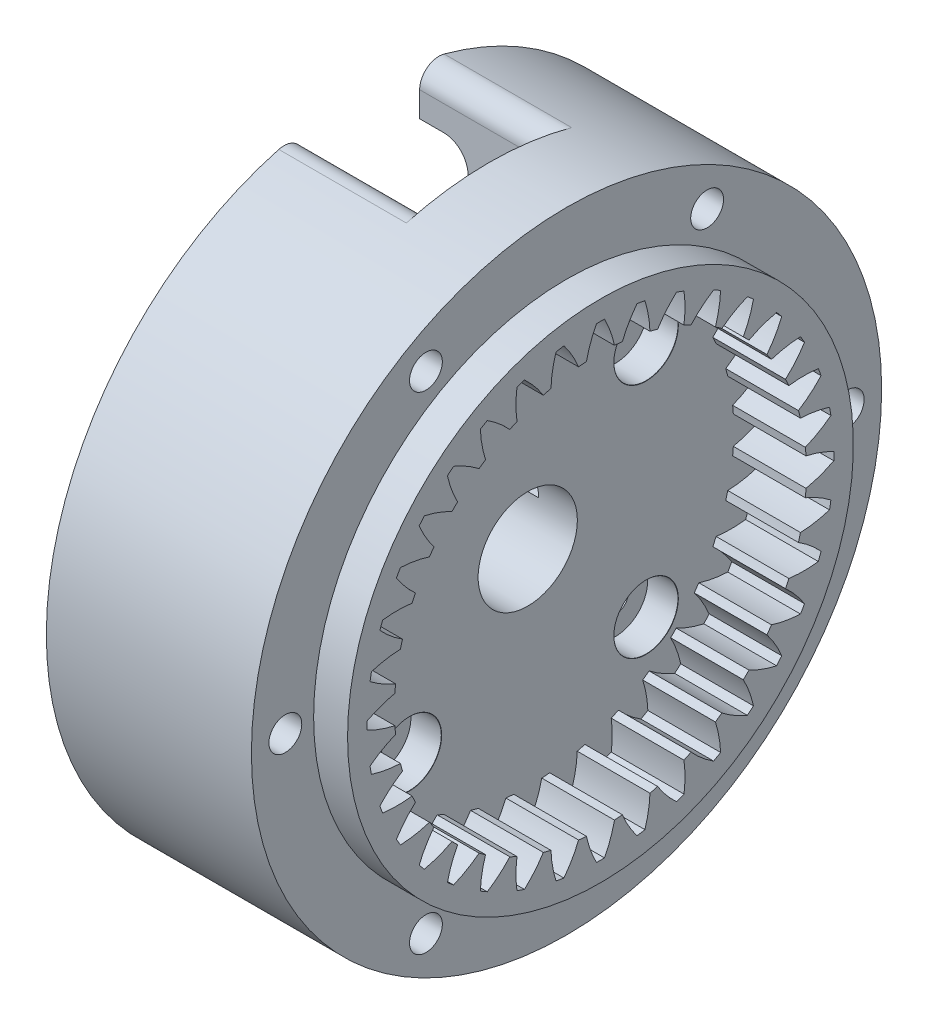
from build123d import *

# Parameters (mm, degrees)
BASPROSKE_W                                         = 9.525
BASPROSKE_H                                         = 3.598545
TOOTHCUT_DEPTH                                      = 45.291510727
TEETHCUTS_COUNT                                     = 36
EXTRUDE_THIN1_START                                 = 9.525
SKETCH3_R                                           = 33.126045
SKETCH3_R_2                                         = 30.586045
EXTRUDE_THIN1_DEPTH                                 = 9.525
EXTRUDE_THIN2_START                                 = 5.08
SKETCH4_R                                           = 39.476045
SKETCH4_R_2                                         = 33.126045
EXTRUDE_THIN2_DEPTH                                 = 5.08
BOSS_EXTRUDE2_START                                 = -5.08
SKETCH9_R                                           = 59.944
SKETCH9_R_2                                         = 39.476045
BOSS_EXTRUDE2_DEPTH                                 = 5.08
SKETCH12_R                                          = 59.944
BOSS_EXTRUDE3_DEPTH                                 = 5.08
SKETCH13_R                                          = 20.2565
SKETCH13_R_2                                        = 17.9705
CUT_EXTRUDE10_DEPTH                                 = 2.032
CUT_EXTRUDE11_DEPTH                                 = 87.022510409
CUT_EXTRUDE11_DEPTH_BACK                            = 87.022510409
SKETCH14_R                                          = 3.302
BOSS_EXTRUDE5_START                                 = 14.605
SKETCH15_R                                          = 59.944
SKETCH15_R_2                                        = 47.498
BOSS_EXTRUDE5_DEPTH                                 = 14.605
CBORE_FOR_00_BINDING_HEAD_MACHINE_SCREW_D           = 5.08
CBORE_FOR_00_BINDING_HEAD_MACHINE_SCREW_CBORE_D     = 7.62
CBORE_FOR_00_BINDING_HEAD_MACHINE_SCREW_CBORE_DEPTH = 1.27
SKETCH21_R                                          = 19.05
CUT_EXTRUDE12_DEPTH                                 = 1.524
SKETCH26_R                                          = 7.62
CUT_EXTRUDE15_DEPTH                                 = 88.901708476
BOSS_EXTRUDE8_START                                 = 1.524
SKETCH28_R                                          = 19.05
SKETCH28_R_2                                        = 7.62
BOSS_EXTRUDE8_DEPTH                                 = 1.524
SKETCH29_R                                          = 44.45
BOSS_EXTRUDE9_DEPTH                                 = 11.62
SKETCH31_W                                          = 15.24
SKETCH31_H                                          = 50.8
CUT_EXTRUDE17_DEPTH                                 = 11.62
SKETCH32_R                                          = 12.7
CUT_EXTRUDE18_DEPTH                                 = 3.175
BOSS_EXTRUDE14_START                                = 2.032
SKETCH38_R                                          = 20.2565
SKETCH38_R_2                                        = 17.9705
BOSS_EXTRUDE14_DEPTH                                = 2.032
CBORE_FOR_M3_HEX_HEAD_MACHINE_SCREW1_AT_COUNT       = 2
CBORE_FOR_M3_HEX_HEAD_MACHINE_SCREW1_AT_PITCH       = 31
CBORE_FOR_M3_HEX_HEAD_MACHINE_SCREW1_2_COUNT        = 2
CBORE_FOR_M3_HEX_HEAD_MACHINE_SCREW1_2_PITCH        = 43.840620434
CBORE_FOR_M3_HEX_HEAD_MACHINE_SCREW1_3_COUNT        = 2
CBORE_FOR_M3_HEX_HEAD_MACHINE_SCREW1_3_PITCH        = 31
SKETCH41_R                                          = 7.62
CUT_EXTRUDE21_DEPTH                                 = 89.316881155
BOSS_EXTRUDE15_START                                = -13.525
SKETCH42_R                                          = 7.62
SKETCH42_R_2                                        = 3
BOSS_EXTRUDE15_DEPTH                                = 13.525
BOSS_EXTRUDE16_START                                = 8.445
BOSS_EXTRUDE16_DEPTH                                = 8.445
SKETCH45_W                                          = 6
SKETCH45_H                                          = 25.4
CUT_EXTRUDE22_DEPTH                                 = 8.445
SKETCH46_W                                          = 15.24
SKETCH46_H                                          = 26.975993355
CUT_EXTRUDE23_DEPTH                                 = 8.445
CUT_EXTRUDE24_START                                 = -13.525
SKETCH47_R                                          = 6.5
CUT_EXTRUDE24_DEPTH                                 = 13.525
FILLET1_R                                           = 2.54
SKETCH50_OUTSIDE_W                                  = 156.57
SKETCH50_OUTSIDE_H                                  = 156.57
SKETCH50_OUTSIDE_R                                  = 41.275
CUT_EXTRUDE25_DEPTH                                 = 88.526765486
SKETCH56_R                                          = 41.275
CUT_EXTRUDE26_DEPTH                                 = 1.27
BOSS_EXTRUDE17_DEPTH                                = 6.35
FILLET2_R                                           = 2.54
FILLET3_R                                           = 3.175
M4_CLEARANCE_HOLE1_D                                = 4.3
CIRPATTERN1_COUNT                                   = 6


with BuildPart() as part:
    # BasProSke → Base-Revolve (revolve)
    with BuildSketch(Plane(origin=(0, 0, 0), x_dir=(1, 0, 0), z_dir=(0, 1, 0)), mode=Mode.PRIVATE) as base_revolve_sk:
        with Locations((4.7625, 28.7867725)):
            Rectangle(BASPROSKE_W, BASPROSKE_H)
    revolve(base_revolve_sk.sketch.rotate(Axis((-10, 0, 0), (1, 0, 0)), 180), axis=Axis((-10, 0, 0), (1, 0, 0)))

    # TooCutSke → ToothCut (cut, through all)
    with BuildSketch(Plane(origin=(0, 0, 0), x_dir=(0, 0, -1), z_dir=(1, 0, 0))):
        with BuildLine():
            ThreePointArc((1.841725032, 26.899124248), (1.308199168, 28.772624617), (0.524789557, 30.556138806))
            ThreePointArc((0.524789557, 30.556138806), (0, 30.560645), (-0.524789557, 30.556138806))
            ThreePointArc((-0.524789557, 30.556138806), (-1.308199168, 28.772624617), (-1.841725032, 26.899124248))
            ThreePointArc((-1.841725032, 26.899124248), (0, 26.9621), (1.841725032, 26.899124248))
        make_face()
    toothcut = extrude(amount=TOOTHCUT_DEPTH, mode=Mode.SUBTRACT)

    # TeethCuts: ToothCut ×36 about axis
    teethcuts_axis = Axis((0, 0, 0), (1, 0, 0))
    for i in range(1, TEETHCUTS_COUNT):
        add(toothcut.rotate(teethcuts_axis, i * 360 / TEETHCUTS_COUNT), mode=Mode.SUBTRACT)

    # Sketch3 → Extrude-Thin1 (add)
    with BuildSketch(Plane(origin=(0, 0, 0), x_dir=(0, 0, -1), z_dir=(1, 0, 0)).offset(EXTRUDE_THIN1_START)):
        Circle(SKETCH3_R)
        Circle(SKETCH3_R_2, mode=Mode.SUBTRACT)
    extrude(amount=-EXTRUDE_THIN1_DEPTH)

    # Sketch4 → Extrude-Thin2 (add)
    with BuildSketch(Plane(origin=(0, 0, 0), x_dir=(0, 0, -1), z_dir=(1, 0, 0)).offset(EXTRUDE_THIN2_START)):
        Circle(SKETCH4_R)
        Circle(SKETCH4_R_2, mode=Mode.SUBTRACT)
    extrude(amount=-EXTRUDE_THIN2_DEPTH)

    # Sketch9 → Boss-Extrude2 (add)
    with BuildSketch(Plane.ZY.offset(BOSS_EXTRUDE2_START)):
        Circle(SKETCH9_R)
        Circle(SKETCH9_R_2, mode=Mode.SUBTRACT)
    extrude(amount=BOSS_EXTRUDE2_DEPTH)

    # Sketch12 → Boss-Extrude3 (add)
    with BuildSketch(Plane.ZY):
        Circle(SKETCH12_R)
    extrude(amount=BOSS_EXTRUDE3_DEPTH)

    # Sketch13 → Cut-Extrude10 (cut)
    with BuildSketch(Plane(origin=(0, 0, 0), x_dir=(0, 0, -1), z_dir=(1, 0, 0))):
        Circle(SKETCH13_R)
        Circle(SKETCH13_R_2, mode=Mode.SUBTRACT)
    extrude(amount=-CUT_EXTRUDE10_DEPTH, mode=Mode.SUBTRACT)

    # Sketch14 → Cut-Extrude11 (cut, two sides: drawn at the far end of the back side and taken through both)
    with BuildSketch(Plane.ZY.offset(5.08).offset(-CUT_EXTRUDE11_DEPTH_BACK)):
        Circle(SKETCH14_R)
    extrude(amount=CUT_EXTRUDE11_DEPTH + CUT_EXTRUDE11_DEPTH_BACK, mode=Mode.SUBTRACT)

    # Sketch15 → Boss-Extrude5 (add)
    with BuildSketch(Plane(origin=(5.08, 0, 0), x_dir=(0, 0, -1), z_dir=(1, 0, 0)).offset(BOSS_EXTRUDE5_START)):
        with Locations(Location((0, 0, 0), (0, 0, 180))):
            Circle(SKETCH15_R)
        with Locations(Location((0, 0, 0), (0, 0, 180))):
            Circle(SKETCH15_R_2, mode=Mode.SUBTRACT)
    extrude(amount=-BOSS_EXTRUDE5_DEPTH)

    # CBORE for #00 Binding Head Machine Screw1 (through all)
    with Locations(Plane.ZY.offset(5.08)):
        with Locations((0, 53.848), (53.848, 0), (0, -53.848), (-53.848, 0)):
            CounterBoreHole(CBORE_FOR_00_BINDING_HEAD_MACHINE_SCREW_D / 2, CBORE_FOR_00_BINDING_HEAD_MACHINE_SCREW_CBORE_D / 2, CBORE_FOR_00_BINDING_HEAD_MACHINE_SCREW_CBORE_DEPTH)

    # Sketch21 → Cut-Extrude12 (cut)
    with BuildSketch(Plane.ZY.offset(5.08)):
        Circle(SKETCH21_R)
    extrude(amount=-CUT_EXTRUDE12_DEPTH, mode=Mode.SUBTRACT)

    # Sketch26 → Cut-Extrude15 (cut, through all)
    with BuildSketch(Plane.ZY.offset(3.556)):
        Circle(SKETCH26_R)
    extrude(amount=-CUT_EXTRUDE15_DEPTH, mode=Mode.SUBTRACT)

    # Sketch28 → Boss-Extrude8 (add)
    with BuildSketch(Plane.ZY.offset(3.556).offset(BOSS_EXTRUDE8_START)):
        Circle(SKETCH28_R)
        Circle(SKETCH28_R_2, mode=Mode.SUBTRACT)
    extrude(amount=-BOSS_EXTRUDE8_DEPTH)

    # Sketch29 → Boss-Extrude9 (add)
    with BuildSketch(Plane.ZY.offset(5.08)):
        Circle(SKETCH29_R)
    extrude(amount=BOSS_EXTRUDE9_DEPTH)

    # Sketch31 → Cut-Extrude17 (cut)
    with BuildSketch(Plane.ZY.offset(16.7)):
        with Locations((0, 25.4)):
            Rectangle(SKETCH31_W, SKETCH31_H)
    extrude(amount=-CUT_EXTRUDE17_DEPTH, mode=Mode.SUBTRACT)

    # Sketch32 → Cut-Extrude18 (cut)
    with BuildSketch(Plane.ZY.offset(16.7)):
        Circle(SKETCH32_R)
    extrude(amount=-CUT_EXTRUDE18_DEPTH, mode=Mode.SUBTRACT)

    # Sketch38 → Boss-Extrude14 (add)
    with BuildSketch(Plane(origin=(-2.032, 0, 0), x_dir=(0, 0, -1), z_dir=(1, 0, 0)).offset(BOSS_EXTRUDE14_START)):
        Circle(SKETCH38_R)
        Circle(SKETCH38_R_2, mode=Mode.SUBTRACT)
    extrude(amount=-BOSS_EXTRUDE14_DEPTH)

    # Sketch40 → CBORE for M3 Hex Head Machine Screw1 (revolve, cut)
    with BuildSketch(Plane(origin=(0, 15.5, -15.5), x_dir=(0, 0, -1), z_dir=(0, 1, 0))):
        Polygon((0, 0), (0, 16.7), (1.7, 16.7), (1.7, 4), (4.2, 4), (4.2, 0.025), (4.225, 0), align=None)
    cbore_for_m3_hex_head_machine_screw1 = revolve(axis=Axis((6.35, 15.5, -15.5), (-1, 0, 0)), mode=Mode.SUBTRACT)

    # CBORE for M3 Hex Head Machine Screw1 at: CBORE for M3 Hex Head Machine Screw1 ×2
    with Locations(*[(0, 0, i * CBORE_FOR_M3_HEX_HEAD_MACHINE_SCREW1_AT_PITCH) for i in range(1, CBORE_FOR_M3_HEX_HEAD_MACHINE_SCREW1_AT_COUNT)]):
        add(cbore_for_m3_hex_head_machine_screw1, mode=Mode.SUBTRACT)

    # CBORE for M3 Hex Head Machine Screw1 2: CBORE for M3 Hex Head Machine Screw1 ×2
    with Locations(*[Vector(0, -0.7071067811865476, 0.7071067811865476) * (i * CBORE_FOR_M3_HEX_HEAD_MACHINE_SCREW1_2_PITCH) for i in range(1, CBORE_FOR_M3_HEX_HEAD_MACHINE_SCREW1_2_COUNT)]):
        add(cbore_for_m3_hex_head_machine_screw1, mode=Mode.SUBTRACT)

    # CBORE for M3 Hex Head Machine Screw1 3: CBORE for M3 Hex Head Machine Screw1 ×2
    with Locations(*[(0, -i * CBORE_FOR_M3_HEX_HEAD_MACHINE_SCREW1_3_PITCH, 0) for i in range(1, CBORE_FOR_M3_HEX_HEAD_MACHINE_SCREW1_3_COUNT)]):
        add(cbore_for_m3_hex_head_machine_screw1, mode=Mode.SUBTRACT)

    # Sketch41 → Cut-Extrude21 (cut, through all)
    with BuildSketch(Plane(origin=(-5.08, 0, 0), x_dir=(0, 0, -1), z_dir=(1, 0, 0))):
        with Locations(Location((0, 0, 0), (0, 0, 180))):
            Circle(SKETCH41_R)
    extrude(amount=-CUT_EXTRUDE21_DEPTH, mode=Mode.SUBTRACT)

    # Sketch42 → Boss-Extrude15 (add)
    with BuildSketch(Plane(origin=(0, 0, 0), x_dir=(0, 0, -1), z_dir=(1, 0, 0)).offset(BOSS_EXTRUDE15_START)):
        Circle(SKETCH42_R)
        Circle(SKETCH42_R_2, mode=Mode.SUBTRACT)
    extrude(amount=BOSS_EXTRUDE15_DEPTH)

    # Sketch43 → Boss-Extrude16 (add)
    with BuildSketch(Plane.ZY.offset(5.08).offset(BOSS_EXTRUDE16_START)):
        with BuildLine():
            Line((-7.62, 0), (-7.62, 10.16))
            ThreePointArc((-7.62, 10.16), (0, 12.7), (7.62, 10.16))
            Line((7.62, 10.16), (7.62, 0))
            ThreePointArc((7.62, 0), (0, 7.62), (-7.62, 0))
        make_face()
    extrude(amount=-BOSS_EXTRUDE16_DEPTH)

    # Sketch45 → Cut-Extrude22 (cut)
    with BuildSketch(Plane.ZY.offset(13.525)):
        with Locations((0, 12.7)):
            Rectangle(SKETCH45_W, SKETCH45_H)
    extrude(amount=-CUT_EXTRUDE22_DEPTH, mode=Mode.SUBTRACT)

    # Sketch46 → Cut-Extrude23 (cut)
    with BuildSketch(Plane.ZY.offset(5.08)):
        with Locations((0, 13.487996677)):
            Rectangle(SKETCH46_W, SKETCH46_H)
    extrude(amount=CUT_EXTRUDE23_DEPTH, mode=Mode.SUBTRACT)

    # Sketch47 → Cut-Extrude24 (cut)
    with BuildSketch(Plane(origin=(0, 0, 0), x_dir=(0, 0, -1), z_dir=(1, 0, 0)).offset(CUT_EXTRUDE24_START)):
        Circle(SKETCH47_R)
    extrude(amount=CUT_EXTRUDE24_DEPTH, mode=Mode.SUBTRACT)

    # Fillet1
    fillet1_edges = [part.edges().sort_by_distance(p)[0] for p in [
        (-5.08, -44.45, 0),
    ]]
    fillet(fillet1_edges, radius=FILLET1_R)

    # Sketch50 outside → Cut-Extrude25 (cut, through all)
    with BuildSketch(Plane(origin=(5.08, 0, 0), x_dir=(0, 0, -1), z_dir=(1, 0, 0))):
        Rectangle(SKETCH50_OUTSIDE_W, SKETCH50_OUTSIDE_H)
        Circle(SKETCH50_OUTSIDE_R, mode=Mode.SUBTRACT)
    extrude(amount=-CUT_EXTRUDE25_DEPTH, mode=Mode.SUBTRACT)


with BuildPart() as cut_extrude25_kept_piece:
    # of the separate pieces the step leaves, the one the design keeps (cut_extrude25_pieces_kept)
    add(part.part.solids().sort_by_distance((-5.08, 0, 6.5))[0])

    # Sketch56 → Cut-Extrude26 (cut)
    with BuildSketch(Plane.ZY.offset(16.7)):
        with Locations(Location((0, 0, 0), (0, 0, 180))):
            Circle(SKETCH56_R)
    extrude(amount=-CUT_EXTRUDE26_DEPTH, mode=Mode.SUBTRACT)

    # Sketch57 → Boss-Extrude17 (add)
    with BuildSketch(Plane.ZY.offset(15.43)):
        with BuildLine():
            Line((7.62, 40.565517684), (7.62, 34.083591727))
            ThreePointArc((7.62, 34.083591727), (0, -34.925), (-7.62, 34.083591727))
            Line((-7.62, 34.083591727), (-7.62, 40.565517684))
            ThreePointArc((-7.62, 40.565517684), (0, -41.275), (7.62, 40.565517684))
        make_face()
    extrude(amount=BOSS_EXTRUDE17_DEPTH)

    # Fillet2
    fillet2_edges = [cut_extrude25_kept_piece.edges().sort_by_distance(p)[0] for p in [
        (-10.255, 40.565517684, -7.62),
        (-13.43, 40.565517684, 7.62),
    ]]
    fillet(fillet2_edges, radius=FILLET2_R)

    # Fillet3
    fillet3_edges = [cut_extrude25_kept_piece.edges().sort_by_distance(p)[0] for p in [
        (-15.43, -34.925, 0),
    ]]
    fillet(fillet3_edges, radius=FILLET3_R)

    # M4 Clearance Hole1 (through all)
    with Locations(Plane(origin=(5.08, 0, 36.83), x_dir=(0, 0, 1), z_dir=(1, 0, 0))):
        with Locations((0, 0)):
            m4_clearance_hole1 = Hole(M4_CLEARANCE_HOLE1_D / 2)

    # CirPattern1: M4 Clearance Hole1 ×6 about axis
    cirpattern1_axis = Axis((0, 0, 0), (1, 0, 0))
    for i in range(1, CIRPATTERN1_COUNT):
        add(m4_clearance_hole1.rotate(cirpattern1_axis, i * 360 / CIRPATTERN1_COUNT), mode=Mode.SUBTRACT)


solid = cut_extrude25_kept_piece.part
